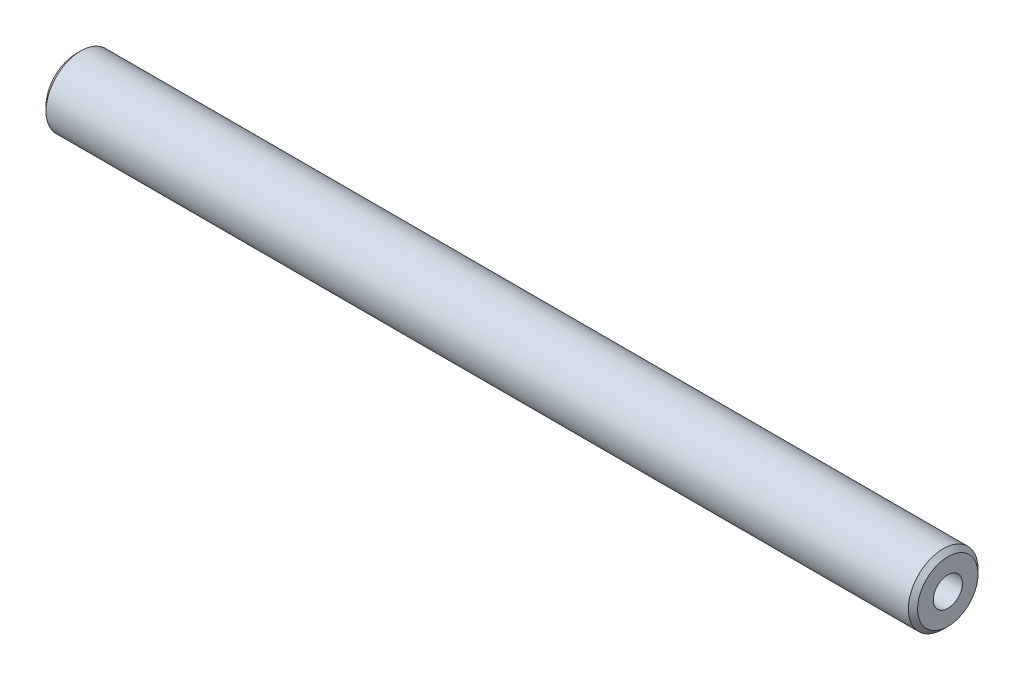
from build123d import *

# Parameters (mm, degrees)
SKETCH1_W           = 75
SKETCH1_H           = 3
CHAMFER1_SIZE       = 0.4
TAPPED_HOLE10_D     = 2.5
TAPPED_HOLE10_DEPTH = 8.5
TAPPED_HOLE10_TIP   = 0.751075774
TAPPED_HOLE11_D     = 2.5
TAPPED_HOLE11_DEPTH = 8.5
TAPPED_HOLE11_TIP   = 0.751075774


with BuildPart() as part:
    # Sketch1 → Revolve1 (revolve)
    with BuildSketch(Plane.XY):
        with Locations((37.5, 1.5)):
            Rectangle(SKETCH1_W, SKETCH1_H)
    revolve(axis=Axis((0, 0, 0), (1, 0, 0)))

    # Chamfer1
    chamfer1_edges = [part.edges().sort_by_distance(p)[0] for p in [
        (75, -3, 0),
        (0, -3, 0),
    ]]
    chamfer(chamfer1_edges, length=CHAMFER1_SIZE)

    # Tapped Hole10
    with Locations(Plane.ZY):
        with Locations((0, 0)):
            Hole(TAPPED_HOLE10_D / 2, depth=TAPPED_HOLE10_DEPTH)
            with Locations((0, 0, -(TAPPED_HOLE10_DEPTH + TAPPED_HOLE10_TIP / 2))):  # 118° drill point
                Cone(0, TAPPED_HOLE10_D / 2, TAPPED_HOLE10_TIP, mode=Mode.SUBTRACT)

    # Tapped Hole11
    with Locations(Plane(origin=(75, 0, 0), x_dir=(0, 0, -1), z_dir=(1, 0, 0))):
        with Locations((0, 0)):
            Hole(TAPPED_HOLE11_D / 2, depth=TAPPED_HOLE11_DEPTH)
            with Locations((0, 0, -(TAPPED_HOLE11_DEPTH + TAPPED_HOLE11_TIP / 2))):  # 118° drill point
                Cone(0, TAPPED_HOLE11_D / 2, TAPPED_HOLE11_TIP, mode=Mode.SUBTRACT)


solid = part.part
